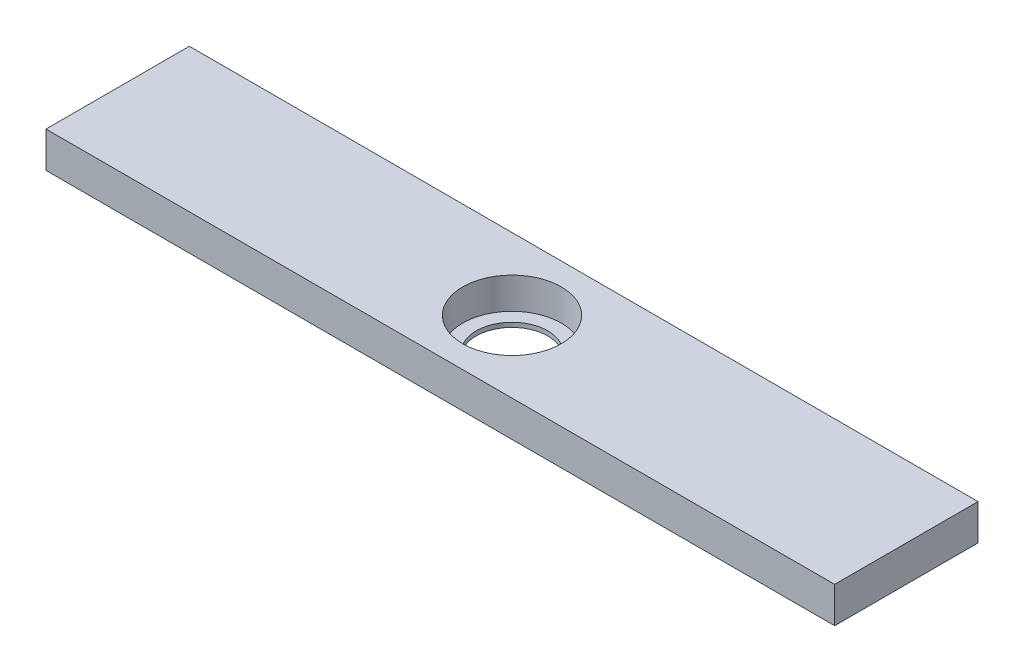
from build123d import *

# Parameters (mm, degrees)
SKETCH1_W           = 279.4
SKETCH1_H           = 50.8
BOSS_EXTRUDE1_DEPTH = 12.7
SKETCH2_R           = 17.4625
CUT_EXTRUDE1_DEPTH  = 11.1125
SKETCH3_R           = 12.7
CUT_EXTRUDE2_DEPTH  = 143.42449809


with BuildPart() as part:
    # Sketch1 → Boss-Extrude1 (new body)
    with BuildSketch(Plane(origin=(0, 0, 0), x_dir=(1, 0, 0), z_dir=(0, 1, 0))):
        Rectangle(SKETCH1_W, SKETCH1_H)
    extrude(amount=BOSS_EXTRUDE1_DEPTH)

    # Sketch2 → Cut-Extrude1 (cut)
    with BuildSketch(Plane(origin=(0, 12.7, 0), x_dir=(1, 0, 0), z_dir=(0, 1, 0))):
        Circle(SKETCH2_R)
    extrude(amount=-CUT_EXTRUDE1_DEPTH, mode=Mode.SUBTRACT)

    # Sketch3 → Cut-Extrude2 (cut, through all)
    with BuildSketch(Plane(origin=(0, 1.5875, 0), x_dir=(1, 0, 0), z_dir=(0, 1, 0))):
        Circle(SKETCH3_R)
    extrude(amount=-CUT_EXTRUDE2_DEPTH, mode=Mode.SUBTRACT)


solid = part.part
